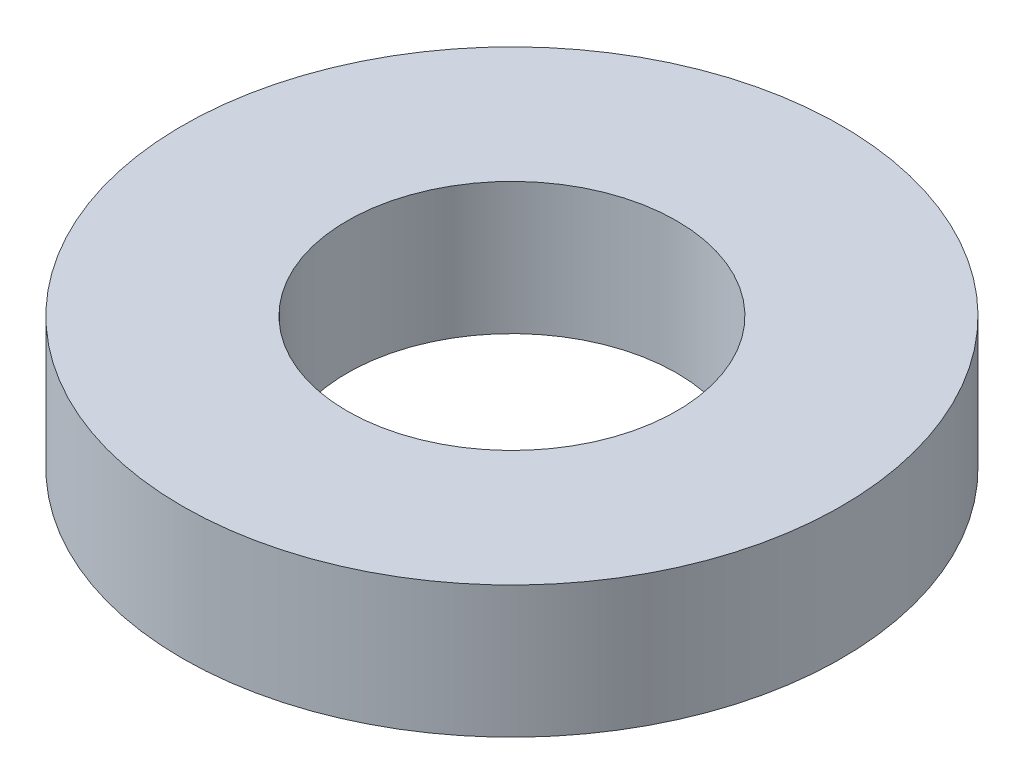
from build123d import *

# Parameters (mm, degrees)
SKETCH1_R           = 60
BOSS_EXTRUDE1_DEPTH = 24
SKETCH2_R           = 30
CUT_EXTRUDE1_DEPTH  = 89.18163074


with BuildPart() as part:
    # Sketch1 → Boss-Extrude1 (new body)
    with BuildSketch(Plane(origin=(0, 0, 0), x_dir=(1, 0, 0), z_dir=(0, 1, 0))):
        Circle(SKETCH1_R)
    extrude(amount=BOSS_EXTRUDE1_DEPTH)

    # Sketch2 → Cut-Extrude1 (cut, through all)
    with BuildSketch(Plane(origin=(0, 0, 0), x_dir=(1, 0, 0), z_dir=(0, 1, 0))):
        Circle(SKETCH2_R)
    extrude(amount=CUT_EXTRUDE1_DEPTH, mode=Mode.SUBTRACT)


solid = part.part
